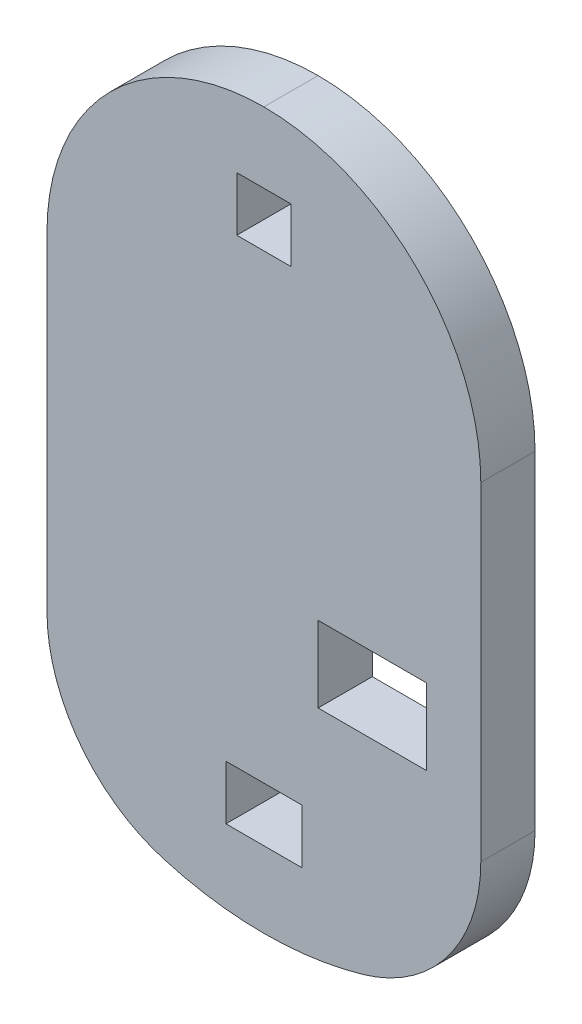
from build123d import *

# Parameters (mm, degrees)
SKETCH1_R           = 33
BOSS_EXTRUDE1_DEPTH = 5
CUT_EXTRUDE3_START  = -10
CUT_EXTRUDE3_DEPTH  = 10
FILLET2_R           = 20
FILLET3_R           = 15
SKETCH7_W           = 5
SKETCH7_H           = 5
SKETCH7_W_2         = 7
CUT_EXTRUDE4_DEPTH  = 10
SKETCH8_W           = 10
SKETCH8_H           = 7
CUT_EXTRUDE5_DEPTH  = 10


with BuildPart() as part:
    # Sketch1 → Boss-Extrude1 (new body)
    with BuildSketch(Plane.XY):
        Circle(SKETCH1_R)
    extrude(amount=BOSS_EXTRUDE1_DEPTH)

    # Sketch6 → Cut-Extrude3 (cut)
    with BuildSketch(Plane.XY.offset(5).offset(CUT_EXTRUDE3_START)):
        with BuildLine():
            Line((-20, 26.248809497), (-20, -26.248809497))
            ThreePointArc((-20, -26.248809497), (-33, 0), (-20, 26.248809497))
        make_face()
        with BuildLine():
            Line((20, -26.248809497), (20, 26.248809497))
            ThreePointArc((20, 26.248809497), (33, 0), (20, -26.248809497))
        make_face()
    extrude(amount=CUT_EXTRUDE3_DEPTH, mode=Mode.SUBTRACT)

    # Fillet2
    fillet2_edges = [part.edges().sort_by_distance(p)[0] for p in [
        (-20, 26.248809497, 2.5),
        (20, 26.248809497, 2.5),
    ]]
    fillet(fillet2_edges, radius=FILLET2_R - 0.0001)  # a hair under: the kernel refuses the full size

    # Fillet3
    fillet3_edges = [part.edges().sort_by_distance(p)[0] for p in [
        (-20, -26.248809497, 2.5),
        (20, -26.248809497, 2.5),
    ]]
    fillet(fillet3_edges, radius=FILLET3_R)

    # Sketch7 → Cut-Extrude4 (cut)
    with BuildSketch(Plane.XY.offset(5)):
        with Locations((0, 24)):
            Rectangle(SKETCH7_W, SKETCH7_H)
        with Locations((0, -23.5)):
            Rectangle(SKETCH7_W_2, SKETCH7_H)
    extrude(amount=-CUT_EXTRUDE4_DEPTH, mode=Mode.SUBTRACT)

    # Sketch8 → Cut-Extrude5 (cut)
    with BuildSketch(Plane.XY.offset(5)):
        with Locations((10, -9)):
            Rectangle(SKETCH8_W, SKETCH8_H)
    extrude(amount=-CUT_EXTRUDE5_DEPTH, mode=Mode.SUBTRACT)


solid = part.part
